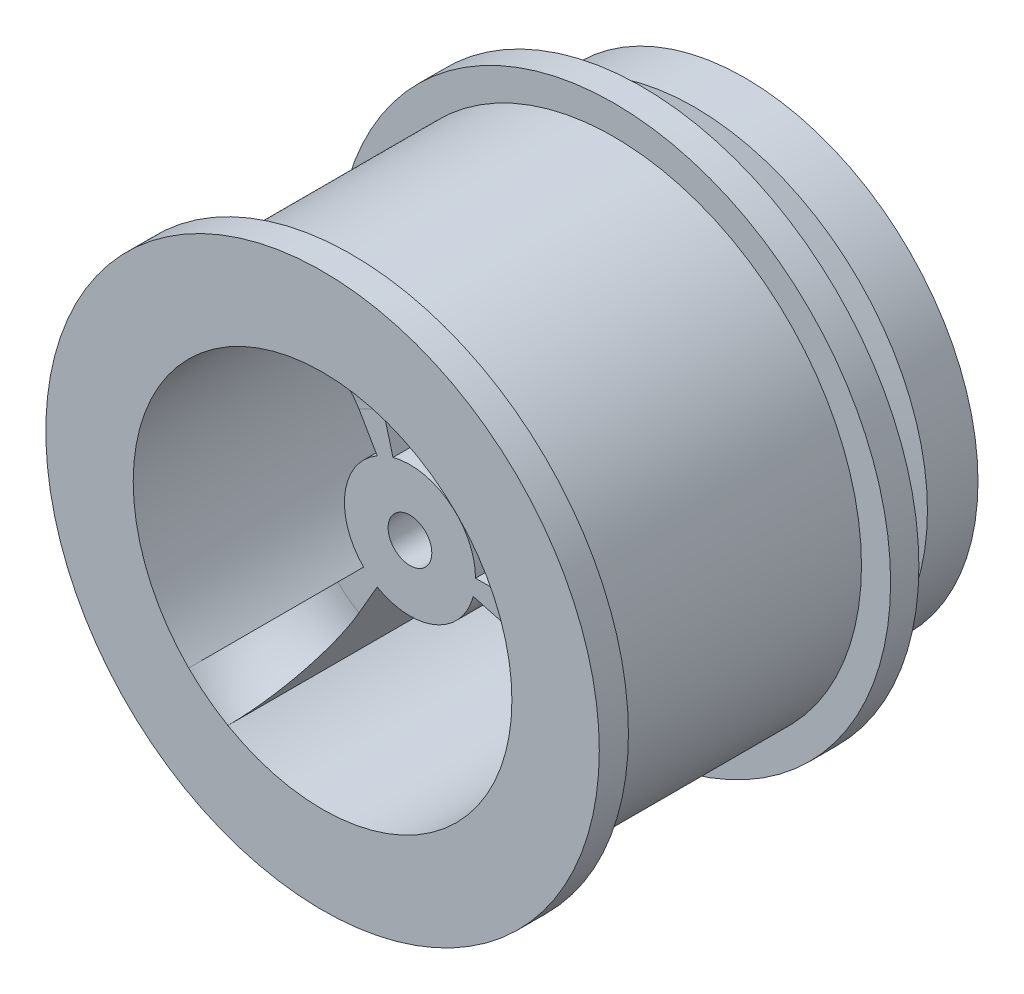
from build123d import *

# Parameters (mm, degrees)
SKETCH1_R             = 8.5
SKETCH1_R_2           = 6.5
BOSS_EXTRUDE1_DEPTH   = 9
SKETCH1_R_3           = 2.25
SKETCH1_R_4           = 0.75
BOSS_EXTRUDE1_2_DEPTH = 9
SKETCH2_R             = 9.5
BOSS_EXTRUDE2_DEPTH   = 1.5
SKETCH3_R             = 9.5
SKETCH3_R_2           = 6.5
BOSS_EXTRUDE3_DEPTH   = 1
BOSS_EXTRUDE4_REACH   = 19.051
CIRPATTERN1_COUNT     = 3
CUT_EXTRUDE2_START    = -2
SKETCH6_R             = 6.5
CUT_EXTRUDE2_DEPTH    = 2
FILLET1_R             = 3
BOSS_EXTRUDE5_START   = 1
SKETCH8_R             = 6.5
BOSS_EXTRUDE5_DEPTH   = 1
SKETCH11_R            = 8
BOSS_EXTRUDE6_DEPTH   = 2
SKETCH7_R             = 1
CUT_EXTRUDE3_DEPTH    = 7
FILLET2_R             = 1
CIRPATTERN2_COUNT     = 3
CUT_EXTRUDE4_START    = -20
SKETCH4_R             = 0.75
CUT_EXTRUDE4_DEPTH    = 20


with BuildPart() as part:
    # Sketch1 → Boss-Extrude1 (new body)
    with BuildSketch(Plane.XY):
        Circle(SKETCH1_R)
        Circle(SKETCH1_R_2, mode=Mode.SUBTRACT)
    extrude(amount=BOSS_EXTRUDE1_DEPTH)



with BuildPart() as body_2:
    # Sketch1 → Boss-Extrude1 2 (new body)
    with BuildSketch(Plane.XY):
        Circle(SKETCH1_R_3)
        Circle(SKETCH1_R_4, mode=Mode.SUBTRACT)
    extrude(amount=BOSS_EXTRUDE1_2_DEPTH)


with BuildPart() as part_1:
    add(part.part)

    add(body_2.part)  # Boss-Extrude2 merges body 2
    # Sketch2 → Boss-Extrude2 (add)
    with BuildSketch(Plane(origin=(0, 0, 0), x_dir=(-1, 0, 0), z_dir=(0, 0, -1))):
        Circle(SKETCH2_R)
    extrude(amount=BOSS_EXTRUDE2_DEPTH)

    # Sketch3 → Boss-Extrude3 (add)
    with BuildSketch(Plane.XY.offset(9)):
        Circle(SKETCH3_R)
        Circle(SKETCH3_R_2, mode=Mode.SUBTRACT)
    extrude(amount=BOSS_EXTRUDE3_DEPTH)

    # Sketch5 → Boss-Extrude4 (add, up to next)
    with BuildSketch(Plane.XY.offset(9), mode=Mode.PRIVATE) as boss_extrude4_sk1:
        with BuildLine():
            Line((2.25, 0), (6.5, 0))
            ThreePointArc((6.5, 0), (6.444391599, -0.848420249), (6.278517871, -1.682323793))
            Line((6.278517871, -1.682323793), (2.173333109, -0.582342851))
            ThreePointArc((2.173333109, -0.582342851), (2.230750938, -0.293683932), (2.25, 0))
        make_face()
    boss_extrude4_tool1 = extrude(boss_extrude4_sk1.sketch, amount=-BOSS_EXTRUDE4_REACH, mode=Mode.PRIVATE) - part_1.part
    boss_extrude4 = boss_extrude4_tool1.solids().sort_by_distance((4.665326, -0.614202, 9))[0]
    add(boss_extrude4)

    # CirPattern1: Boss-Extrude4 ×3 about axis
    cirpattern1_axis = Axis((0, 0, 0), (0, 0, 1))
    for i in range(1, CIRPATTERN1_COUNT):
        add(boss_extrude4.rotate(cirpattern1_axis, i * 360 / CIRPATTERN1_COUNT))

    # Sketch6 → Cut-Extrude2 (cut)
    with BuildSketch(Plane.XY.offset(9).offset(CUT_EXTRUDE2_START)):
        Circle(SKETCH6_R)
    extrude(amount=CUT_EXTRUDE2_DEPTH, mode=Mode.SUBTRACT)

    # Fillet1
    # the kernel refuses this fillet: 3 mm, written as the material it adds along each edge
    with BuildSketch(Plane(origin=(0, 0, 7), x_dir=(0.9659258262890711, -0.2588190451025104, 0), z_dir=(-0.2588190451025104, -0.9659258262890711, 0))) as fillet1_piece_1:
        with BuildLine():
            CenterArc((6.5 - FILLET1_R, FILLET1_R), FILLET1_R, 270, 90)
            Line((6.5 - FILLET1_R, 0), (6.5, 0))
            Line((6.5, 0), (6.5, FILLET1_R))
        make_face()
    revolve(axis=Axis((0, 0, 7), (0, 0, 1)), revolution_arc=15)
    with BuildSketch(Plane(origin=(0, 0, 7), x_dir=(-0.2588190451025142, 0.9659258262890701, 0), z_dir=(0.9659258262890701, 0.2588190451025142, 0))) as fillet1_piece_2:
        with BuildLine():
            CenterArc((6.5 - FILLET1_R, FILLET1_R), FILLET1_R, 270, 90)
            Line((6.5 - FILLET1_R, 0), (6.5, 0))
            Line((6.5, 0), (6.5, FILLET1_R))
        make_face()
    revolve(axis=Axis((0, 0, 7), (0, 0, 1)), revolution_arc=15)
    with BuildSketch(Plane(origin=(0, 0, 7), x_dir=(-0.7071067811865505, -0.7071067811865446, 0), z_dir=(-0.7071067811865446, 0.7071067811865505, 0))) as fillet1_piece_3:
        with BuildLine():
            CenterArc((6.5 - FILLET1_R, FILLET1_R), FILLET1_R, 270, 90)
            Line((6.5 - FILLET1_R, 0), (6.5, 0))
            Line((6.5, 0), (6.5, FILLET1_R))
        make_face()
    revolve(axis=Axis((0, 0, 7), (0, 0, 1)), revolution_arc=15)

    # Sketch8 → Boss-Extrude5 (add)
    with BuildSketch(Plane(origin=(0, 0, -1.5), x_dir=(-1, 0, 0), z_dir=(0, 0, -1)).offset(BOSS_EXTRUDE5_START)):
        Circle(SKETCH8_R)
    extrude(amount=-BOSS_EXTRUDE5_DEPTH)

    # Sketch11 → Boss-Extrude6 (add)
    with BuildSketch(Plane(origin=(0, 0, -2.5), x_dir=(-1, 0, 0), z_dir=(0, 0, -1))):
        Circle(SKETCH11_R)
    extrude(amount=BOSS_EXTRUDE6_DEPTH)

    # Sketch7 → Cut-Extrude3 (cut)
    with BuildSketch(Plane.XY):
        with Locations((1.722075446, -4.157457896)):
            Circle(SKETCH7_R)
    cut_extrude3 = extrude(amount=-CUT_EXTRUDE3_DEPTH, mode=Mode.SUBTRACT)

    # Fillet2
    # the kernel refuses this fillet: 1 mm, written as the material it adds along each edge
    with BuildSketch(Plane(origin=(0, 0, 0), x_dir=(0.9268638778365579, -0.37539759184333915, 0), z_dir=(-0.37539759184333915, -0.9268638778365579, 0))) as fillet2_piece_1:
        with BuildLine():
            CenterArc((6.5 - FILLET2_R, FILLET2_R), FILLET2_R, 270, 90)
            Line((6.5 - FILLET2_R, 0), (6.5, 0))
            Line((6.5, 0), (6.5, FILLET2_R))
        make_face()
    revolve(axis=Axis((0, 0, 0), (0, 0, 1)), revolution_arc=149.097777135)
    with BuildSketch(Plane(origin=(-0.25, 0, 0), x_dir=(0, 0, 1), z_dir=(1, 0, 0))) as fillet2_piece_2_section:
        with BuildLine():
            CenterArc((FILLET2_R, -FILLET2_R), FILLET2_R, 90, 90)
            Line((0, -FILLET2_R), (0, 0))
            Line((0, 0), (FILLET2_R, 0))
        make_face()
    fillet2_piece_2 = extrude(amount=9.25, mode=Mode.PRIVATE)
    fillet2_piece_2 = fillet2_piece_2 & Plane(origin=(0, 0, 0.222961637), x_dir=(1, 0, 0), z_dir=(0, 0, -1)) * Cylinder(6.5, 23, mode=Mode.PRIVATE)
    fillet2_piece_2 = fillet2_piece_2 - Plane(origin=(0, 0, 0.222961637), x_dir=(1, 0, 0), z_dir=(0, 0, -1)) * Cylinder(0.75, 23, mode=Mode.PRIVATE)
    add(fillet2_piece_2)
    with BuildSketch(Plane(origin=(8.693332437, -2.329371406, 0), x_dir=(-0.25881904510252135, -0.9659258262890682, 0), z_dir=(-0.9659258262890682, 0.25881904510252135, 0))) as fillet2_piece_3_section:
        with BuildLine():
            CenterArc((FILLET2_R, FILLET2_R), FILLET2_R, 180, 90)
            Line((0, FILLET2_R), (0, 0))
            Line((0, 0), (FILLET2_R, 0))
        make_face()
    fillet2_piece_3 = extrude(amount=9.25, mode=Mode.PRIVATE)
    fillet2_piece_3 = fillet2_piece_3 & Plane(origin=(0, 0, 0.22296165), x_dir=(1, 0, 0), z_dir=(0, 0, -1)) * Cylinder(8.5, 23, mode=Mode.PRIVATE)
    fillet2_piece_3 = fillet2_piece_3 - Plane(origin=(0, 0, 0.22296165), x_dir=(1, 0, 0), z_dir=(0, 0, -1)) * Cylinder(0.75, 23, mode=Mode.PRIVATE)
    add(fillet2_piece_3)
    with BuildSketch(Plane(origin=(0, 0, 0), x_dir=(-0.138328087862445, 0.9903864599782852, 0), z_dir=(0.9903864599782852, 0.138328087862445, 0))) as fillet2_piece_4:
        with BuildLine():
            CenterArc((6.5 - FILLET2_R, FILLET2_R), FILLET2_R, 270, 90)
            Line((6.5 - FILLET2_R, 0), (6.5, 0))
            Line((6.5, 0), (6.5, FILLET2_R))
        make_face()
    revolve(axis=Axis((0, 0, 0), (0, 0, 1)), revolution_arc=149.097777135)
    with BuildSketch(Plane(origin=(0, 0, 0), x_dir=(0.5547978045957125, 0.8319852138204006, 0), z_dir=(0.8319852138204006, -0.5547978045957125, 0))) as fillet2_piece_5:
        with BuildLine():
            CenterArc((2.25 + FILLET2_R, FILLET2_R), FILLET2_R, 180, 90)
            Line((2.25 + FILLET2_R, 0), (2.25, 0))
            Line((2.25, 0), (2.25, FILLET2_R))
        make_face()
    revolve(axis=Axis((0, 0, 0), (0, 0, 1)), revolution_arc=232.393578389)
    with BuildSketch(Plane(origin=(0.125, -0.216506351, 0), x_dir=(0, 0, 1), z_dir=(-0.49999999999999983, 0.8660254037844388, 0))) as fillet2_piece_6_section:
        with BuildLine():
            CenterArc((FILLET2_R, -FILLET2_R), FILLET2_R, 90, 90)
            Line((0, -FILLET2_R), (0, 0))
            Line((0, 0), (FILLET2_R, 0))
        make_face()
    fillet2_piece_6 = extrude(amount=9.25, mode=Mode.PRIVATE)
    fillet2_piece_6 = fillet2_piece_6 & Plane(origin=(0, 0, 0.222961635), x_dir=(1, 0, 0), z_dir=(0, 0, -1)) * Cylinder(6.5, 23, mode=Mode.PRIVATE)
    fillet2_piece_6 = fillet2_piece_6 - Plane(origin=(0, 0, 0.222961635), x_dir=(1, 0, 0), z_dir=(0, 0, -1)) * Cylinder(0.75, 23, mode=Mode.PRIVATE)
    add(fillet2_piece_6)
    with BuildSketch(Plane(origin=(-2.329371406, 8.693332437, 0), x_dir=(0, 0, 1), z_dir=(0.25881904510251996, -0.9659258262890685, 0))) as fillet2_piece_7_section:
        with BuildLine():
            CenterArc((FILLET2_R, -FILLET2_R), FILLET2_R, 90, 90)
            Line((0, -FILLET2_R), (0, 0))
            Line((0, 0), (FILLET2_R, 0))
        make_face()
    fillet2_piece_7 = extrude(amount=9.25, mode=Mode.PRIVATE)
    fillet2_piece_7 = fillet2_piece_7 & Plane(origin=(0, 0, 0.222961632), x_dir=(1, 0, 0), z_dir=(0, 0, -1)) * Cylinder(6.5, 23, mode=Mode.PRIVATE)
    fillet2_piece_7 = fillet2_piece_7 - Plane(origin=(0, 0, 0.222961632), x_dir=(1, 0, 0), z_dir=(0, 0, -1)) * Cylinder(0.75, 23, mode=Mode.PRIVATE)
    add(fillet2_piece_7)
    with BuildSketch(Plane(origin=(0, 0, 0), x_dir=(-0.7885357899741134, -0.614988868134945, 0), z_dir=(-0.614988868134945, 0.7885357899741134, 0))) as fillet2_piece_8:
        with BuildLine():
            CenterArc((6.5 - FILLET2_R, FILLET2_R), FILLET2_R, 270, 90)
            Line((6.5, FILLET2_R), (6.5, 0))
            Line((6.5, 0), (6.5 - FILLET2_R, 0))
        make_face()
    revolve(axis=Axis((0, 0, 0), (0, 0, 1)), revolution_arc=149.097777135)
    with BuildSketch(Plane(origin=(0, 0, 0), x_dir=(-0.9979192330393512, 0.06447638583352278, 0), z_dir=(0.06447638583352278, 0.9979192330393512, 0))) as fillet2_piece_9:
        with BuildLine():
            CenterArc((2.25 + FILLET2_R, FILLET2_R), FILLET2_R, 180, 90)
            Line((2.25, FILLET2_R), (2.25, 0))
            Line((2.25, 0), (2.25 + FILLET2_R, 0))
        make_face()
    revolve(axis=Axis((0, 0, 0), (0, 0, 1)), revolution_arc=232.393578389)
    with BuildSketch(Plane(origin=(0.125, 0.216506351, 0), x_dir=(0.8660254037844384, -0.5000000000000004, 0), z_dir=(-0.5000000000000004, -0.8660254037844384, 0))) as fillet2_piece_10_section:
        with BuildLine():
            CenterArc((FILLET2_R, FILLET2_R), FILLET2_R, 180, 90)
            Line((0, FILLET2_R), (0, 0))
            Line((0, 0), (FILLET2_R, 0))
        make_face()
    fillet2_piece_10 = extrude(amount=9.25, mode=Mode.PRIVATE)
    fillet2_piece_10 = fillet2_piece_10 & Plane(origin=(0, 0, 0.222961624), x_dir=(1, 0, 0), z_dir=(0, 0, -1)) * Cylinder(8.5, 23, mode=Mode.PRIVATE)
    fillet2_piece_10 = fillet2_piece_10 - Plane(origin=(0, 0, 0.222961624), x_dir=(1, 0, 0), z_dir=(0, 0, -1)) * Cylinder(0.75, 23, mode=Mode.PRIVATE)
    add(fillet2_piece_10)
    with BuildSketch(Plane(origin=(-6.363961031, -6.363961031, 0), x_dir=(0, 0, 1), z_dir=(0.7071067811865483, 0.7071067811865468, 0))) as fillet2_piece_11_section:
        with BuildLine():
            CenterArc((FILLET2_R, -FILLET2_R), FILLET2_R, 90, 90)
            Line((0, -FILLET2_R), (0, 0))
            Line((0, 0), (FILLET2_R, 0))
        make_face()
    fillet2_piece_11 = extrude(amount=9.25, mode=Mode.PRIVATE)
    fillet2_piece_11 = fillet2_piece_11 & Plane(origin=(0, 0, 0.22296162), x_dir=(1, 0, 0), z_dir=(0, 0, -1)) * Cylinder(6.5, 23, mode=Mode.PRIVATE)
    fillet2_piece_11 = fillet2_piece_11 - Plane(origin=(0, 0, 0.22296162), x_dir=(1, 0, 0), z_dir=(0, 0, -1)) * Cylinder(0.75, 23, mode=Mode.PRIVATE)
    add(fillet2_piece_11)
    with BuildSketch(Plane(origin=(0, 0, 0), x_dir=(0.44312142844363894, -0.8964615996539222, 0), z_dir=(-0.8964615996539222, -0.44312142844363894, 0))) as fillet2_piece_12:
        with BuildLine():
            CenterArc((2.25 + FILLET2_R, FILLET2_R), FILLET2_R, 180, 90)
            Line((2.25 + FILLET2_R, 0), (2.25, 0))
            Line((2.25, 0), (2.25, FILLET2_R))
        make_face()
    revolve(axis=Axis((0, 0, 0), (0, 0, 1)), revolution_arc=232.393578389)

    # CirPattern2: Cut-Extrude3 ×3 about axis
    cirpattern2_axis = Axis((0, 0, 0), (0, 0, 1))
    for i in range(1, CIRPATTERN2_COUNT):
        add(cut_extrude3.rotate(cirpattern2_axis, i * 360 / CIRPATTERN2_COUNT), mode=Mode.SUBTRACT)

    # Sketch4 → Cut-Extrude4 (cut)
    with BuildSketch(Plane.XY.offset(7).offset(CUT_EXTRUDE4_START)):
        with Locations(Location((0, 0, 0), (0, 0, 180))):
            Circle(SKETCH4_R)
    extrude(amount=CUT_EXTRUDE4_DEPTH, mode=Mode.SUBTRACT)

    # Sketch12 → Cut-Revolve1 (revolve, cut)
    with BuildSketch(Plane(origin=(0, 0, 0), x_dir=(1, 0, 0), z_dir=(0, 1, 0)), mode=Mode.PRIVATE) as cut_revolve1_sk:
        Polygon((6.5, 2.5), (10.5, 3.205307923), (10.5, 0.794692077), (6.5, 1.5), align=None)
    revolve(cut_revolve1_sk.sketch.rotate(Axis((0, 0, 0), (0, 0, -1)), 180), axis=Axis((0, 0, 0), (0, 0, -1)), mode=Mode.SUBTRACT)


solid = part_1.part
